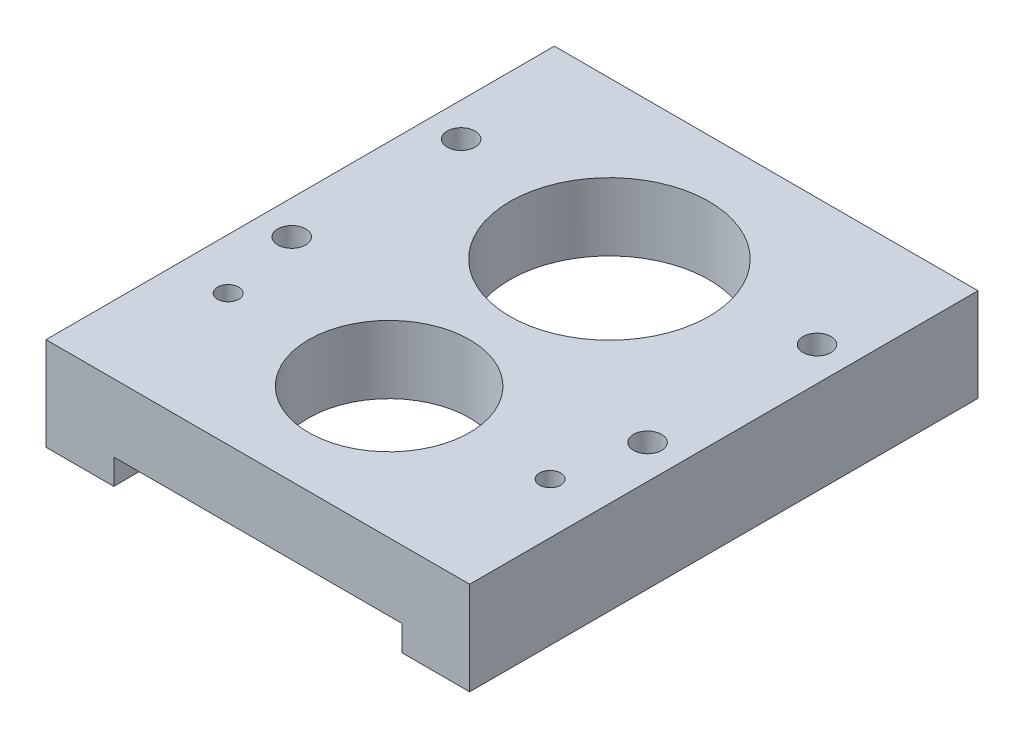
from build123d import *

# Parameters (mm, degrees)
EXTRUDE_1_DEPTH     = 60
SKETCH_2_R          = 11.75
CUT_EXTRUDE_1_DEPTH = 40
SKETCH_3_R          = 9.5
CUT_EXTRUDE_2_DEPTH = 40
M3X0_5_1_D          = 2.5
M3X0_5_1_DEPTH      = 5
M3X0_5_1_TIP        = 0.751075774
CUT_EXTRUDE_3_REACH = 67.924
SKETCH_7_R          = 1.65


with BuildPart() as part:
    # 草圖1 → 填料-伸長1 (new body)
    with BuildSketch(Plane.XY):
        Polygon((-25, 0), (-17, 0), (-17, 3), (17, 3), (17, 0), (25, 0), (25, 11), (-25, 11), align=None)
    extrude(amount=EXTRUDE_1_DEPTH)

    # 草圖2 → 除料-伸長1 (cut)
    with BuildSketch(Plane(origin=(0, 11, 0), x_dir=(1, 0, 0), z_dir=(0, 1, 0))):
        with Locations((0, -18.5)):
            Circle(SKETCH_2_R)
    extrude(amount=-CUT_EXTRUDE_1_DEPTH, mode=Mode.SUBTRACT)

    # 草圖3 → 除料-伸長2 (cut)
    with BuildSketch(Plane(origin=(0, 11, 0), x_dir=(1, 0, 0), z_dir=(0, 1, 0))):
        with Locations((0, -44.5)):
            Circle(SKETCH_3_R)
    extrude(amount=-CUT_EXTRUDE_2_DEPTH, mode=Mode.SUBTRACT)

    # M3x0.5 螺紋孔1
    with Locations(Plane(origin=(0, 11, 0), x_dir=(1, 0, 0), z_dir=(0, 1, 0))):
        with Locations((19, -44.5), (-19, -44.5)):
            Hole(M3X0_5_1_D / 2, depth=M3X0_5_1_DEPTH)
            with Locations((0, 0, -(M3X0_5_1_DEPTH + M3X0_5_1_TIP / 2))):  # 118° drill point
                Cone(0, M3X0_5_1_D / 2, M3X0_5_1_TIP, mode=Mode.SUBTRACT)

    # 草圖7 → 除料-伸長3 (cut, up to next)
    with BuildSketch(Plane(origin=(0, 11, 0), x_dir=(1, 0, 0), z_dir=(0, 1, 0)), mode=Mode.PRIVATE) as cut_extrude_3_sk1:
        with Locations((-21, -35)):
            Circle(SKETCH_7_R)
    cut_extrude_3_tool1 = extrude(cut_extrude_3_sk1.sketch, amount=-CUT_EXTRUDE_3_REACH, mode=Mode.PRIVATE) & part.part
    # 草圖7 → 除料-伸長3 (cut, up to next)
    with BuildSketch(Plane(origin=(0, 11, 0), x_dir=(1, 0, 0), z_dir=(0, 1, 0)), mode=Mode.PRIVATE) as cut_extrude_3_sk2:
        with Locations((-21, -15)):
            Circle(SKETCH_7_R)
    cut_extrude_3_tool2 = extrude(cut_extrude_3_sk2.sketch, amount=-CUT_EXTRUDE_3_REACH, mode=Mode.PRIVATE) & part.part
    # 草圖7 → 除料-伸長3 (cut, up to next)
    with BuildSketch(Plane(origin=(0, 11, 0), x_dir=(1, 0, 0), z_dir=(0, 1, 0)), mode=Mode.PRIVATE) as cut_extrude_3_sk3:
        with Locations((21, -35)):
            Circle(SKETCH_7_R)
    cut_extrude_3_tool3 = extrude(cut_extrude_3_sk3.sketch, amount=-CUT_EXTRUDE_3_REACH, mode=Mode.PRIVATE) & part.part
    # 草圖7 → 除料-伸長3 (cut, up to next)
    with BuildSketch(Plane(origin=(0, 11, 0), x_dir=(1, 0, 0), z_dir=(0, 1, 0)), mode=Mode.PRIVATE) as cut_extrude_3_sk4:
        with Locations((21, -15)):
            Circle(SKETCH_7_R)
    cut_extrude_3_tool4 = extrude(cut_extrude_3_sk4.sketch, amount=-CUT_EXTRUDE_3_REACH, mode=Mode.PRIVATE) & part.part
    add(cut_extrude_3_tool1.solids().sort_by_distance((-21, 11, 35))[0], mode=Mode.SUBTRACT)
    add(cut_extrude_3_tool2.solids().sort_by_distance((-21, 11, 15))[0], mode=Mode.SUBTRACT)
    add(cut_extrude_3_tool3.solids().sort_by_distance((21, 11, 35))[0], mode=Mode.SUBTRACT)
    add(cut_extrude_3_tool4.solids().sort_by_distance((21, 11, 15))[0], mode=Mode.SUBTRACT)


solid = part.part
